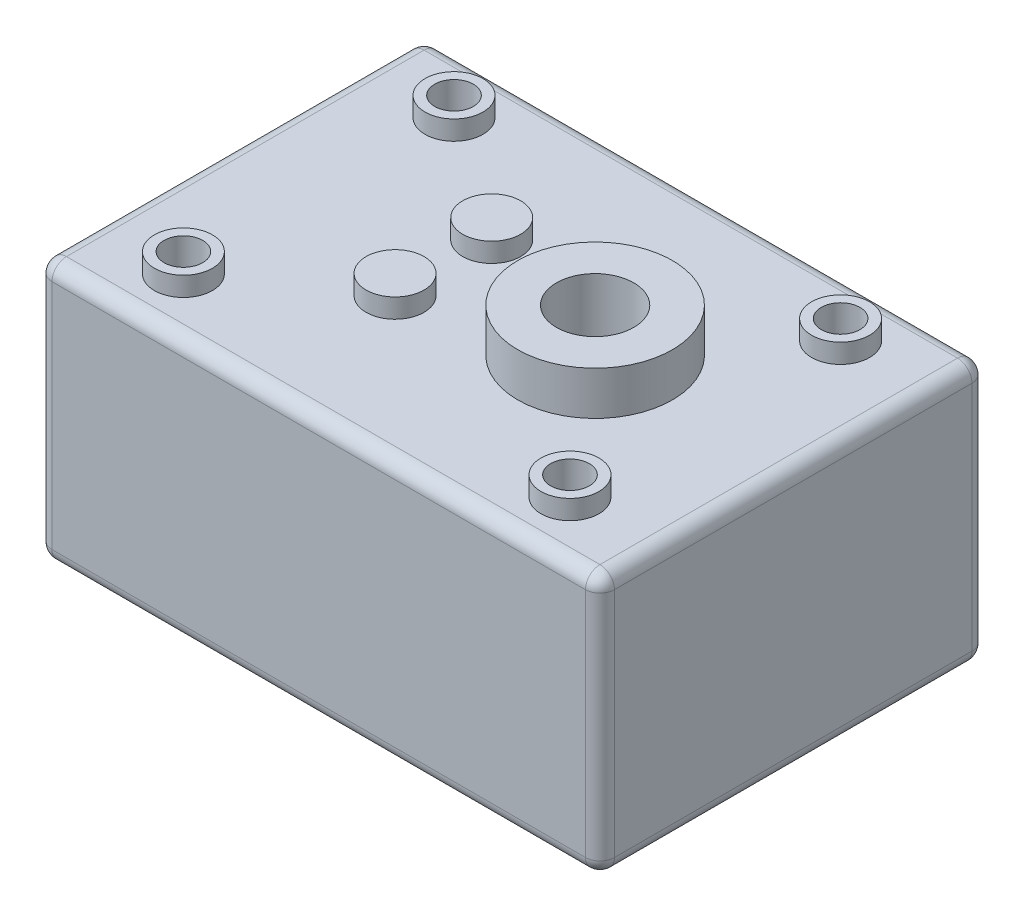
from build123d import *

# Parameters (mm, degrees)
SKETCH1_W            = 58.2
SKETCH1_H            = 40
BOSS_EXTRUDE1_DEPTH  = 27
SKETCH2_R            = 3
BOSS_EXTRUDE2_DEPTH  = 2
SKETCH3_R            = 2
CUT_EXTRUDE1_DEPTH   = 31
SKETCH4_R            = 3
BOSS_EXTRUDE3_DEPTH  = 2
SKETCH5_R            = 2
CUT_EXTRUDE2_DEPTH   = 31
SKETCH6_R            = 3
BOSS_EXTRUDE4_DEPTH  = 2
SKETCH7_R            = 2
CUT_EXTRUDE3_DEPTH   = 31
SKETCH8_R            = 3
BOSS_EXTRUDE5_DEPTH  = 2
SKETCH9_R            = 2
CUT_EXTRUDE4_DEPTH   = 31
SKETCH10_R           = 8
BOSS_EXTRUDE6_DEPTH  = 4.5
SKETCH11_R           = 4
CUT_EXTRUDE5_DEPTH   = 36
BOSS_EXTRUDE7_START  = 2
SKETCH12_R           = 3
BOSS_EXTRUDE7_DEPTH  = 2
BOSS_EXTRUDE8_START  = 2
SKETCH13_R           = 3
BOSS_EXTRUDE8_DEPTH  = 2
BOSS_EXTRUDE9_START  = 4.5
SKETCH15_R           = 8
BOSS_EXTRUDE9_DEPTH  = 4.5
SKETCH18_R           = 2
CUT_EXTRUDE11_DEPTH  = 78.32716211
SKETCH19_R           = 4
CUT_EXTRUDE12_DEPTH  = 78.32716211
SKETCH20_R           = 2
CUT_EXTRUDE13_DEPTH  = 78.32716211
SKETCH24_R           = 3
BOSS_EXTRUDE11_DEPTH = 2
SKETCH25_R           = 3
BOSS_EXTRUDE12_DEPTH = 2
BOSS_EXTRUDE13_START = 2
SKETCH26_R           = 3
BOSS_EXTRUDE13_DEPTH = 2
BOSS_EXTRUDE14_START = 2
SKETCH27_R           = 3
BOSS_EXTRUDE14_DEPTH = 2
FILLET5_R            = 1.5
FILLET6_R            = 1.5


with BuildPart() as part:
    # Sketch1 → Boss-Extrude1 (new body)
    with BuildSketch(Plane(origin=(0, 0, 0), x_dir=(1, 0, 0), z_dir=(0, 1, 0))):
        with Locations((-29.1, 20)):
            Rectangle(SKETCH1_W, SKETCH1_H)
    extrude(amount=BOSS_EXTRUDE1_DEPTH)

    # Sketch2 → Boss-Extrude2 (add)
    with BuildSketch(Plane(origin=(0, 27, 0), x_dir=(1, 0, 0), z_dir=(0, 1, 0))):
        with Locations(Location((-49.1, 34, 0), (0, 0, 270))):
            Circle(SKETCH2_R)
    extrude(amount=BOSS_EXTRUDE2_DEPTH)

    # Sketch3 → Cut-Extrude1 (cut)
    with BuildSketch(Plane(origin=(0, 29, 0), x_dir=(1, 0, 0), z_dir=(0, 1, 0))):
        with Locations(Location((-49.1, 34, 0), (0, 0, 270))):
            Circle(SKETCH3_R)
    extrude(amount=-CUT_EXTRUDE1_DEPTH, mode=Mode.SUBTRACT)

    # Sketch4 → Boss-Extrude3 (add)
    with BuildSketch(Plane(origin=(0, 27, 0), x_dir=(1, 0, 0), z_dir=(0, 1, 0))):
        with Locations(Location((-9.1, 34, 0), (0, 0, 270))):
            Circle(SKETCH4_R)
    extrude(amount=BOSS_EXTRUDE3_DEPTH)

    # Sketch5 → Cut-Extrude2 (cut)
    with BuildSketch(Plane(origin=(0, 29, 0), x_dir=(1, 0, 0), z_dir=(0, 1, 0))):
        with Locations(Location((-9.1, 34, 0), (0, 0, 270))):
            Circle(SKETCH5_R)
    extrude(amount=-CUT_EXTRUDE2_DEPTH, mode=Mode.SUBTRACT)

    # Sketch6 → Boss-Extrude4 (add)
    with BuildSketch(Plane(origin=(0, 27, 0), x_dir=(1, 0, 0), z_dir=(0, 1, 0))):
        with Locations(Location((-49.1, 6, 0), (0, 0, 270))):
            Circle(SKETCH6_R)
    extrude(amount=BOSS_EXTRUDE4_DEPTH)

    # Sketch7 → Cut-Extrude3 (cut)
    with BuildSketch(Plane(origin=(0, 29, 0), x_dir=(1, 0, 0), z_dir=(0, 1, 0))):
        with Locations(Location((-49.1, 6, 0), (0, 0, 270))):
            Circle(SKETCH7_R)
    extrude(amount=-CUT_EXTRUDE3_DEPTH, mode=Mode.SUBTRACT)

    # Sketch8 → Boss-Extrude5 (add)
    with BuildSketch(Plane(origin=(0, 27, 0), x_dir=(1, 0, 0), z_dir=(0, 1, 0))):
        with Locations(Location((-9.1, 6, 0), (0, 0, 270))):
            Circle(SKETCH8_R)
    extrude(amount=BOSS_EXTRUDE5_DEPTH)

    # Sketch9 → Cut-Extrude4 (cut)
    with BuildSketch(Plane(origin=(0, 29, 0), x_dir=(1, 0, 0), z_dir=(0, 1, 0))):
        with Locations(Location((-9.1, 6, 0), (0, 0, 270))):
            Circle(SKETCH9_R)
    extrude(amount=-CUT_EXTRUDE4_DEPTH, mode=Mode.SUBTRACT)

    # Sketch10 → Boss-Extrude6 (add)
    with BuildSketch(Plane(origin=(0, 27, 0), x_dir=(1, 0, 0), z_dir=(0, 1, 0))):
        with Locations(Location((-20.5, 20, 0), (0, 0, 270))):
            Circle(SKETCH10_R)
    extrude(amount=BOSS_EXTRUDE6_DEPTH)

    # Sketch11 → Cut-Extrude5 (cut)
    with BuildSketch(Plane(origin=(0, 31.5, 0), x_dir=(1, 0, 0), z_dir=(0, 1, 0))):
        with Locations(Location((-20.5, 20, 0), (0, 0, 270))):
            Circle(SKETCH11_R)
    extrude(amount=-CUT_EXTRUDE5_DEPTH, mode=Mode.SUBTRACT)

    # Sketch12 → Boss-Extrude7 (add)
    with BuildSketch(Plane.XZ.offset(BOSS_EXTRUDE7_START)):
        with Locations(Location((-49.1, -6, 0), (0, 0, 90))):
            Circle(SKETCH12_R)
    extrude(amount=-BOSS_EXTRUDE7_DEPTH)

    # Sketch13 → Boss-Extrude8 (add)
    with BuildSketch(Plane.XZ.offset(BOSS_EXTRUDE8_START)):
        with Locations(Location((-49.1, -34, 0), (0, 0, 90))):
            Circle(SKETCH13_R)
        with Locations(Location((-9.1, -6, 0), (0, 0, 90))):
            Circle(SKETCH13_R)
        with Locations(Location((-9.1, -34, 0), (0, 0, 90))):
            Circle(SKETCH13_R)
    extrude(amount=-BOSS_EXTRUDE8_DEPTH)

    # Sketch15 → Boss-Extrude9 (add)
    with BuildSketch(Plane.XZ.offset(BOSS_EXTRUDE9_START)):
        with Locations(Location((-20.5, -20, 0), (0, 0, 90))):
            Circle(SKETCH15_R)
    extrude(amount=-BOSS_EXTRUDE9_DEPTH)

    # Sketch18 → Cut-Extrude11 (cut, through all)
    with BuildSketch(Plane(origin=(0, 0, 0), x_dir=(1, 0, 0), z_dir=(0, 1, 0))):
        with Locations(Location((-9.1, 6, 0), (0, 0, 270))):
            Circle(SKETCH18_R)
    extrude(amount=-CUT_EXTRUDE11_DEPTH, mode=Mode.SUBTRACT)

    # Sketch19 → Cut-Extrude12 (cut, through all)
    with BuildSketch(Plane(origin=(0, 0, 0), x_dir=(1, 0, 0), z_dir=(0, 1, 0))):
        with Locations(Location((-20.5, 20, 0), (0, 0, 270))):
            Circle(SKETCH19_R)
    extrude(amount=-CUT_EXTRUDE12_DEPTH, mode=Mode.SUBTRACT)

    # Sketch20 → Cut-Extrude13 (cut, through all)
    with BuildSketch(Plane(origin=(0, 0, 0), x_dir=(1, 0, 0), z_dir=(0, 1, 0))):
        with Locations(Location((-49.1, 34, 0), (0, 0, 270))):
            Circle(SKETCH20_R)
        with Locations(Location((-49.1, 6, 0), (0, 0, 270))):
            Circle(SKETCH20_R)
        with Locations(Location((-9.1, 34, 0), (0, 0, 270))):
            Circle(SKETCH20_R)
    extrude(amount=-CUT_EXTRUDE13_DEPTH, mode=Mode.SUBTRACT)

    # Sketch24 → Boss-Extrude11 (add)
    with BuildSketch(Plane(origin=(0, 27, 0), x_dir=(1, 0, 0), z_dir=(0, 1, 0))):
        with Locations(Location((-36.2, 15, 0), (0, 0, 270))):
            Circle(SKETCH24_R)
    extrude(amount=BOSS_EXTRUDE11_DEPTH)

    # Sketch25 → Boss-Extrude12 (add)
    with BuildSketch(Plane(origin=(0, 27, 0), x_dir=(1, 0, 0), z_dir=(0, 1, 0))):
        with Locations(Location((-36.2, 25, 0), (0, 0, 270))):
            Circle(SKETCH25_R)
    extrude(amount=BOSS_EXTRUDE12_DEPTH)

    # Sketch26 → Boss-Extrude13 (add)
    with BuildSketch(Plane.XZ.offset(BOSS_EXTRUDE13_START)):
        with Locations(Location((-36.2, -15, 0), (0, 0, 90))):
            Circle(SKETCH26_R)
    extrude(amount=-BOSS_EXTRUDE13_DEPTH)

    # Sketch27 → Boss-Extrude14 (add)
    with BuildSketch(Plane.XZ.offset(BOSS_EXTRUDE14_START)):
        with Locations(Location((-36.2, -25, 0), (0, 0, 90))):
            Circle(SKETCH27_R)
    extrude(amount=-BOSS_EXTRUDE14_DEPTH)

    # Fillet5
    fillet5_edges = [part.edges().sort_by_distance(p)[0] for p in [
        (-58.2, 27, -20),
        (-29.1, 27, 0),
        (0, 27, -20),
        (-29.1, 0, 0),
        (-58.2, 0, -20),
        (-29.1, 0, -40),
        (0, 0, -20),
        (0, 13.5, 0),
        (-58.2, 13.5, 0),
        (-58.2, 13.5, -40),
        (-29.1, 27, -40),
    ]]
    fillet(fillet5_edges, radius=FILLET5_R)

    # Fillet6
    # the kernel refuses this fillet: 1.5 mm, written as the material it takes off along each edge
    with BuildSketch(Plane(origin=(-1.5, 1.5, -38.5), x_dir=(0, 0, -1), z_dir=(1, 0, 0))) as fillet6_piece_1_section:
        Polygon((0, 0), (FILLET6_R, 0), (FILLET6_R, -FILLET6_R), (0, -FILLET6_R), align=None)
    fillet6_piece_1 = extrude(amount=FILLET6_R, mode=Mode.PRIVATE)
    fillet6_piece_1 = fillet6_piece_1 - Plane(origin=(-1.5, 1.5, -38.5), x_dir=(0, 0.7071067811865475, 0.7071067811865475), z_dir=(1, 0, 0)) * Sphere(FILLET6_R, mode=Mode.PRIVATE)
    add(fillet6_piece_1, mode=Mode.SUBTRACT)
    with BuildSketch(Plane(origin=(-1.5, 25.5, -38.5), x_dir=(0, 0, -1), z_dir=(1, 0, 0))) as fillet6_piece_2_section:
        Polygon((0, 0), (FILLET6_R, 0), (FILLET6_R, FILLET6_R), (0, FILLET6_R), align=None)
    fillet6_piece_2 = extrude(amount=FILLET6_R, mode=Mode.PRIVATE)
    fillet6_piece_2 = fillet6_piece_2 - Plane(origin=(-1.5, 25.5, -38.5), x_dir=(0, -0.7071067811865475, 0.7071067811865475), z_dir=(1, 0, 0)) * Sphere(FILLET6_R, mode=Mode.PRIVATE)
    add(fillet6_piece_2, mode=Mode.SUBTRACT)
    with BuildSketch(Plane(origin=(0, 1.5, -40), x_dir=(0, 0, 1), z_dir=(0, 1, 0))) as fillet6_piece_3:
        with BuildLine():
            CenterArc((FILLET6_R, -FILLET6_R), FILLET6_R, 90, 90)
            Line((0, -FILLET6_R), (0, 0))
            Line((0, 0), (FILLET6_R, 0))
        make_face()
    extrude(amount=24, mode=Mode.SUBTRACT)


solid = part.part
